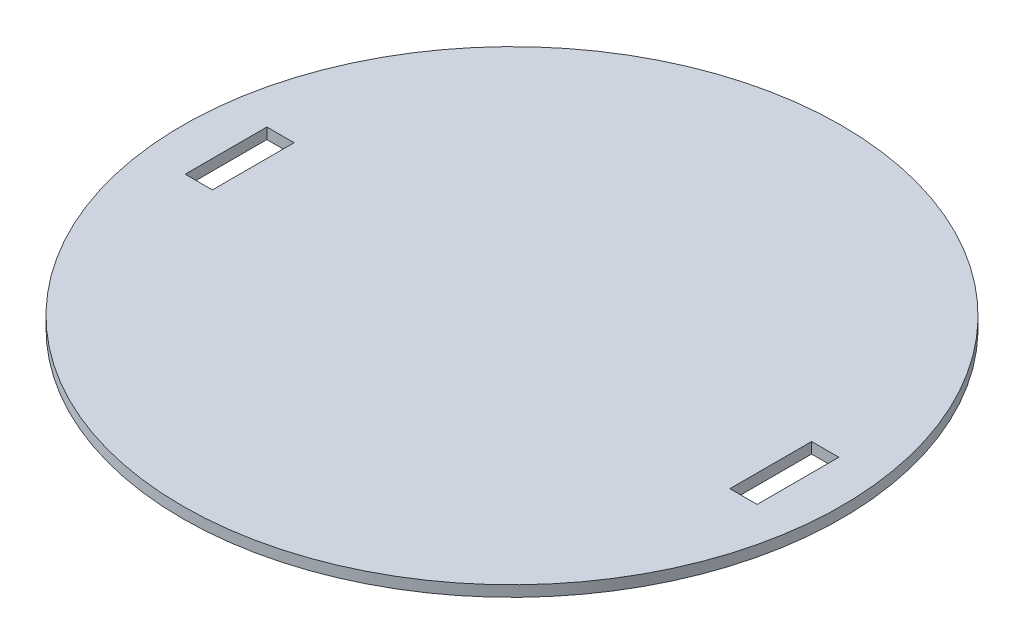
from build123d import *

# Parameters (mm, degrees)
BOTTOM_R             = 121
BOTTOM_W             = 10
BOTTOM_H             = 30
BOTTOM_EXTRUDE_DEPTH = 4


with BuildPart() as part:
    # Bottom → Bottom-Extrude (new body)
    with BuildSketch(Plane(origin=(0, 0, 0), x_dir=(-1, 0, 0), z_dir=(0, 1, 0))):
        Circle(BOTTOM_R)
        with Locations((100, 0)):
            Rectangle(BOTTOM_W, BOTTOM_H, mode=Mode.SUBTRACT)
        with Locations((-100, 0)):
            Rectangle(BOTTOM_W, BOTTOM_H, mode=Mode.SUBTRACT)
    extrude(amount=BOTTOM_EXTRUDE_DEPTH)


solid = part.part
